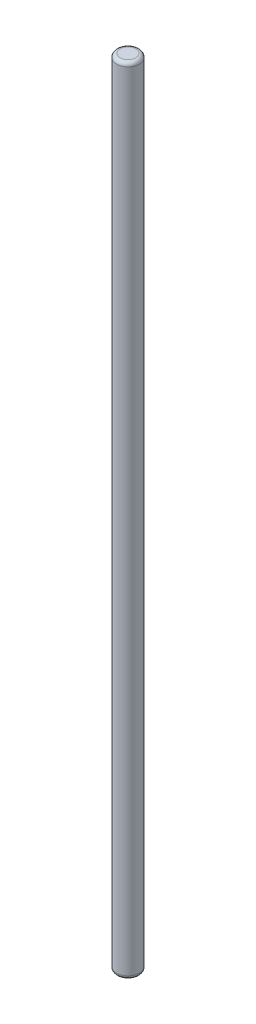
from build123d import *

# Parameters (mm, degrees)
SKETCH1_R           = 2.38125
BOSS_EXTRUDE1_DEPTH = 165.1
FILLET1_R           = 0.762


with BuildPart() as part:
    # Sketch1 → Boss-Extrude1 (new body)
    with BuildSketch(Plane(origin=(0, 0, 0), x_dir=(1, 0, 0), z_dir=(0, 1, 0))):
        Circle(SKETCH1_R)
    extrude(amount=BOSS_EXTRUDE1_DEPTH)

    # Fillet1
    fillet1_edges = [part.edges().sort_by_distance(p)[0] for p in [
        (-2.38125, 0, 0),
        (-2.38125, 165.1, 0),
    ]]
    fillet(fillet1_edges, radius=FILLET1_R)


solid = part.part
